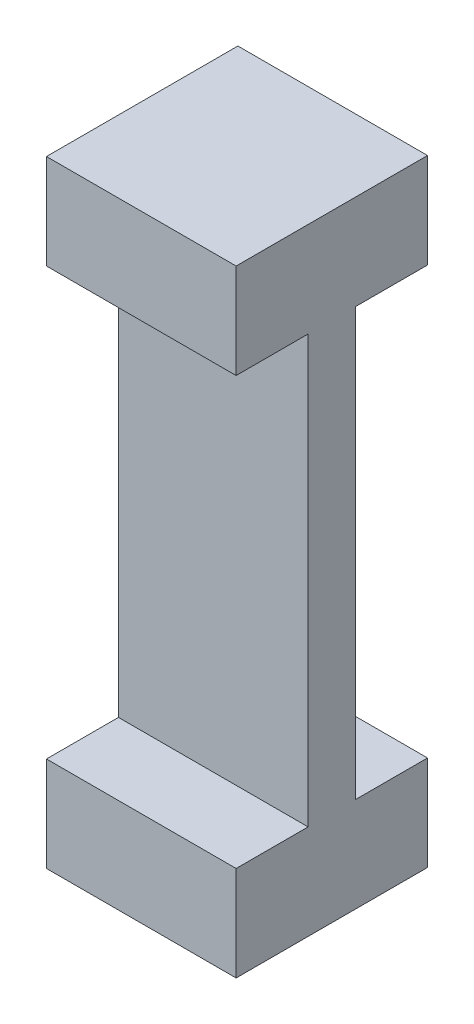
from build123d import *

# Parameters (mm, degrees)
SKETCH1_W           = 79.968077757
SKETCH1_H           = 80.704842411
BOSS_EXTRUDE1_DEPTH = 130
SKETCH2_W           = 30.352421206
SKETCH2_H           = 320
SKETCH2_W_2         = 30.352421205
CUT_EXTRUDE1_DEPTH  = 80
MIRROR3_START       = -31.568063376
MIRROR3_DEPTH       = 79.968077757


# Read off the part's stored shape, not the designer's step: Mirror3
with BuildPart() as part:
    # Sketch1 → Boss-Extrude1 (new body)
    with BuildSketch(Plane(origin=(0, 0, 0), x_dir=(1, 0, 0), z_dir=(0, 1, 0))):
        with Locations((8.415975503, -0.026706735)):
            Rectangle(SKETCH1_W, SKETCH1_H)
    extrude(amount=BOSS_EXTRUDE1_DEPTH)

    # Sketch2 → Cut-Extrude1 (cut)
    with BuildSketch(Plane(origin=(48.400014381, 0, 0), x_dir=(0, 0, -1), z_dir=(1, 0, 0))):
        with Locations((-25.202917338, 200)):
            Rectangle(SKETCH2_W, SKETCH2_H)
        with Locations((25.149503868, 200)):
            Rectangle(SKETCH2_W_2, SKETCH2_H)
    extrude(amount=-CUT_EXTRUDE1_DEPTH, mode=Mode.SUBTRACT)

    # Mirror3 outline → Mirror3 (add)
    with BuildSketch(Plane.YZ.offset(MIRROR3_START)):
        Polygon((220, -40.32571447), (260, -40.32571447), (260, 40.379127941), (220, 40.379127941), (220, 10.026706735), (130, 10.026706735), (130, -9.973293265), (220, -9.973293265), align=None)
    extrude(amount=MIRROR3_DEPTH)


solid = part.part
